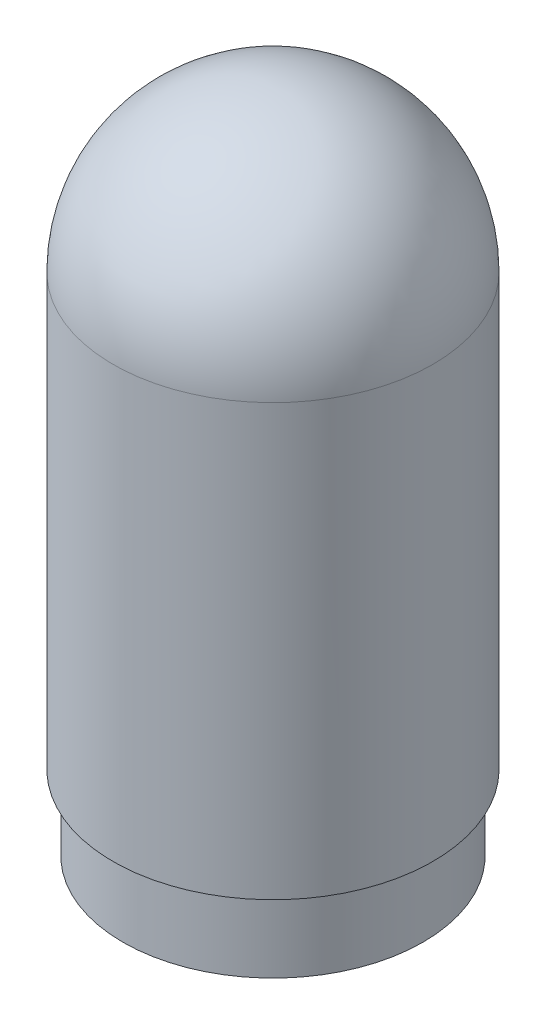
from build123d import *

# Parameters (mm, degrees)
SKETCH1_R           = 30.5
SKETCH1_R_2         = 22.5
BOSS_EXTRUDE2_DEPTH = 15


with BuildPart() as part:
    # Sketch1 → Boss-Extrude2 (new body)
    with BuildSketch(Plane(origin=(0, 0, 0), x_dir=(1, 0, 0), z_dir=(0, 1, 0))):
        Circle(SKETCH1_R)
        Circle(SKETCH1_R_2, mode=Mode.SUBTRACT)
    extrude(amount=BOSS_EXTRUDE2_DEPTH)


with BuildPart() as body_2:
    # Sketch5 → Revolve2 (revolve)
    with BuildSketch(Plane.XY):
        with BuildLine():
            Line((0, 15.208932423), (32.5, 15.208932423))
            Line((32.5, 15.208932423), (32.5, 102.70890373))
            ThreePointArc((32.5, 102.70890373), (22.980980533, 125.689892667), (0, 135.208932423))
            Line((0, 135.208932423), (0, 15.208932423))
        make_face()
    revolve(axis=Axis((0, 24.300324325, 0), (0, 1, 0)))

    # Sketch6 → Cut-Revolve2 (revolve, cut)
    with BuildSketch(Plane.XY):
        with BuildLine():
            Line((22.5, 15), (22.5, 102.70890373))
            ThreePointArc((22.5, 102.70890373), (15.909902577, 118.618806306), (0, 125.20890373))
            Line((0, 125.20890373), (0, 15))
            Line((0, 15), (22.5, 15))
        make_face()
    revolve(axis=Axis((0, 102.70890373, 0), (0, -1, 0)), mode=Mode.SUBTRACT)


solid = Compound([part.part, body_2.part])
